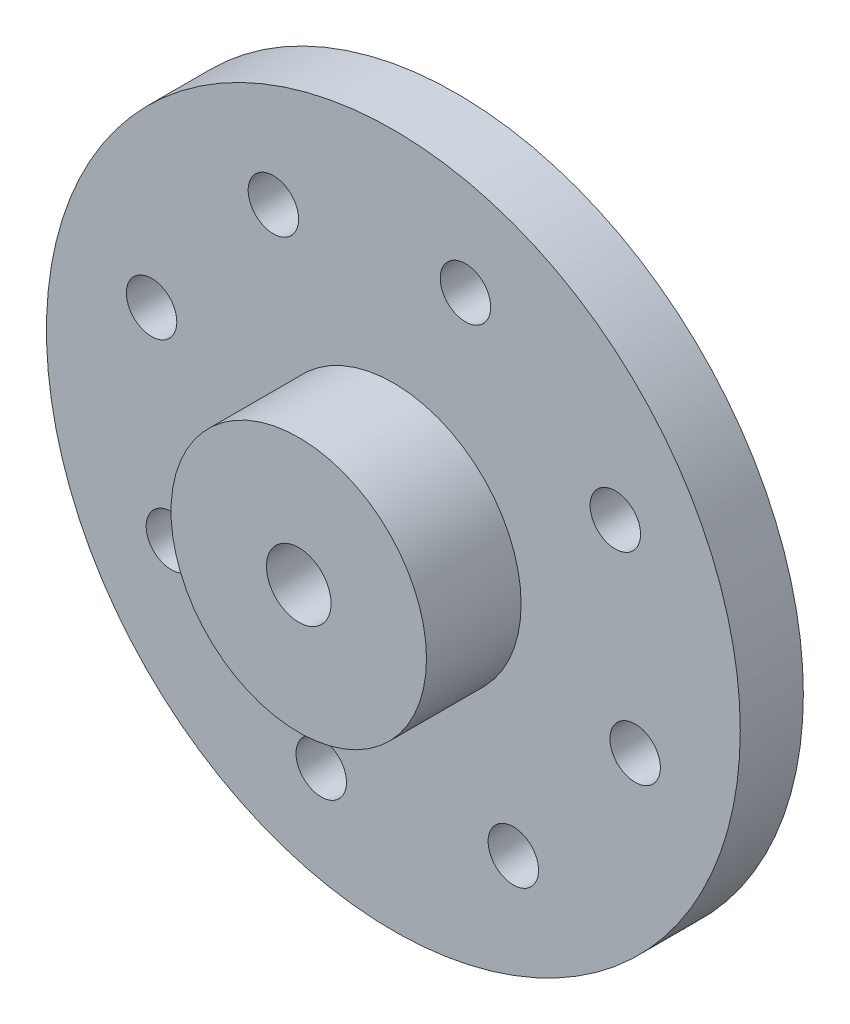
from build123d import *

# Parameters (mm, degrees)
SKETCH1_R                  = 11
SKETCH1_R_2                = 2.669858215
BOSS_EXTRUDE1_DEPTH        = 2
SKETCH2_R                  = 4.05
BOSS_EXTRUDE2_DEPTH        = 3
BOSS_EXTRUDE3_START        = 1
SKETCH3_R                  = 4
SKETCH3_R_2                = 2.669858215
BOSS_EXTRUDE3_DEPTH        = 1
CHAMFER1_SIZE              = 0.6
SKETCH5_W                  = 0.8
SKETCH5_H                  = 3
M2_TAPPED_HOLE1_AT_2_COUNT = 2
M2_TAPPED_HOLE1_AT_2_PITCH = 6.122934918
M2_TAPPED_HOLE1_AT_3_COUNT = 2
M2_TAPPED_HOLE1_AT_3_PITCH = 11.313708499
M2_TAPPED_HOLE1_AT_4_COUNT = 2
M2_TAPPED_HOLE1_AT_4_PITCH = 14.78207252
M2_TAPPED_HOLE1_AT_5_COUNT = 2
M2_TAPPED_HOLE1_AT_5_PITCH = 16
M2_TAPPED_HOLE1_AT_6_COUNT = 2
M2_TAPPED_HOLE1_AT_6_PITCH = 14.78207252
M2_TAPPED_HOLE1_AT_7_COUNT = 2
M2_TAPPED_HOLE1_AT_7_PITCH = 11.313708499
M2_TAPPED_HOLE1_AT_8_COUNT = 2
M2_TAPPED_HOLE1_AT_8_PITCH = 6.122934918
M2_TAPPED_HOLE1_AT_9_COUNT = 2
M2_TAPPED_HOLE1_AT_9_PITCH = 8
M2_5_TAPPED_HOLE1_D        = 2.05
M2_5_TAPPED_HOLE1_DEPTH    = 6.35
M2_5_TAPPED_HOLE1_TIP      = 0.615882135


with BuildPart() as part:
    # Sketch1 → Boss-Extrude1 (new body)
    with BuildSketch(Plane.XY):
        Circle(SKETCH1_R)
        Circle(SKETCH1_R_2, mode=Mode.SUBTRACT)
    extrude(amount=BOSS_EXTRUDE1_DEPTH)

    # Sketch2 → Boss-Extrude2 (add)
    with BuildSketch(Plane.XY.offset(2)):
        Circle(SKETCH2_R)
    extrude(amount=BOSS_EXTRUDE2_DEPTH)

    # Sketch3 → Boss-Extrude3 (add)
    with BuildSketch(Plane(origin=(0, 0, 0), x_dir=(-1, 0, 0), z_dir=(0, 0, -1)).offset(BOSS_EXTRUDE3_START)):
        Circle(SKETCH3_R)
        Circle(SKETCH3_R_2, mode=Mode.SUBTRACT)
    extrude(amount=-BOSS_EXTRUDE3_DEPTH)

    # Chamfer1
    chamfer1_edges = [part.edges().sort_by_distance(p)[0] for p in [
        (4, 0, -1),
    ]]
    chamfer(chamfer1_edges, length=CHAMFER1_SIZE)

    # Sketch5 → M2 Tapped Hole1 (revolve, cut)
    with BuildSketch(Plane(origin=(2.286188648, 7.666377336, 2), x_dir=(0, -1, 0), z_dir=(1, 0, 0))):
        with Locations((0.4, 1.5)):
            Rectangle(SKETCH5_W, SKETCH5_H)
    m2_tapped_hole1 = revolve(axis=Axis((2.286188648, 7.666377336, 8.35), (0, 0, -1)), mode=Mode.SUBTRACT)

    # M2 Tapped Hole1 at 2: M2 Tapped Hole1 ×2
    with Locations(*[Vector(0.7759903238450763, -0.6307448115512436, 0) * (i * M2_TAPPED_HOLE1_AT_2_PITCH) for i in range(1, M2_TAPPED_HOLE1_AT_2_COUNT)]):
        add(m2_tapped_hole1, mode=Mode.SUBTRACT)

    # M2 Tapped Hole1 at 3: M2 Tapped Hole1 ×2
    with Locations(*[Vector(0.4755459881963693, -0.879690862241014, 0) * (i * M2_TAPPED_HOLE1_AT_3_PITCH) for i in range(1, M2_TAPPED_HOLE1_AT_3_COUNT)]):
        add(m2_tapped_hole1, mode=Mode.SUBTRACT)

    # M2 Tapped Hole1 at 4: M2 Tapped Hole1 ×2
    with Locations(*[Vector(0.10270408667988305, -0.9947119535721138, 0) * (i * M2_TAPPED_HOLE1_AT_4_PITCH) for i in range(1, M2_TAPPED_HOLE1_AT_4_COUNT)]):
        add(m2_tapped_hole1, mode=Mode.SUBTRACT)

    # M2 Tapped Hole1 at 5: M2 Tapped Hole1 ×2
    with Locations(*[Vector(-0.2857735810187513, -0.9582971670581726, 0) * (i * M2_TAPPED_HOLE1_AT_5_PITCH) for i in range(1, M2_TAPPED_HOLE1_AT_5_COUNT)]):
        add(m2_tapped_hole1, mode=Mode.SUBTRACT)

    # M2 Tapped Hole1 at 6: M2 Tapped Hole1 ×2
    with Locations(*[Vector(-0.6307448115512436, -0.7759903238450762, 0) * (i * M2_TAPPED_HOLE1_AT_6_PITCH) for i in range(1, M2_TAPPED_HOLE1_AT_6_COUNT)]):
        add(m2_tapped_hole1, mode=Mode.SUBTRACT)

    # M2 Tapped Hole1 at 7: M2 Tapped Hole1 ×2
    with Locations(*[Vector(-0.8796908622410139, -0.4755459881963694, 0) * (i * M2_TAPPED_HOLE1_AT_7_PITCH) for i in range(1, M2_TAPPED_HOLE1_AT_7_COUNT)]):
        add(m2_tapped_hole1, mode=Mode.SUBTRACT)

    # M2 Tapped Hole1 at 8: M2 Tapped Hole1 ×2
    with Locations(*[Vector(-0.9947119535721138, -0.1027040866798832, 0) * (i * M2_TAPPED_HOLE1_AT_8_PITCH) for i in range(1, M2_TAPPED_HOLE1_AT_8_COUNT)]):
        add(m2_tapped_hole1, mode=Mode.SUBTRACT)

    # M2 Tapped Hole1 at 9: M2 Tapped Hole1 ×2
    with Locations(*[Vector(-0.2857735810187514, -0.9582971670581726, 0) * (i * M2_TAPPED_HOLE1_AT_9_PITCH) for i in range(1, M2_TAPPED_HOLE1_AT_9_COUNT)]):
        add(m2_tapped_hole1, mode=Mode.SUBTRACT)

    # M2.5 Tapped Hole1
    with Locations(Plane.XY.offset(5)):
        with Locations((0, 0)):
            Hole(M2_5_TAPPED_HOLE1_D / 2, depth=M2_5_TAPPED_HOLE1_DEPTH)
            with Locations((0, 0, -(M2_5_TAPPED_HOLE1_DEPTH + M2_5_TAPPED_HOLE1_TIP / 2))):  # 118° drill point
                Cone(0, M2_5_TAPPED_HOLE1_D / 2, M2_5_TAPPED_HOLE1_TIP, mode=Mode.SUBTRACT)


solid = part.part
